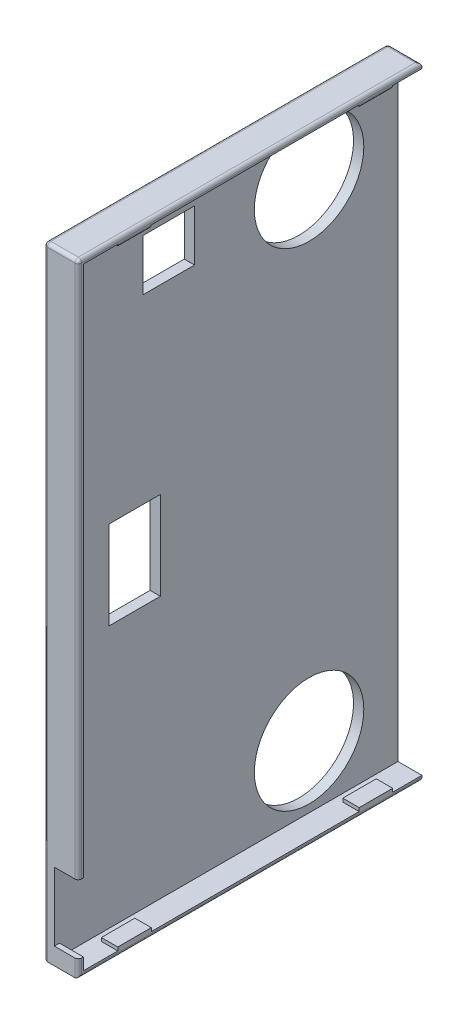
from build123d import *

# Parameters (mm, degrees)
ESBO_O1_W                 = 182
ESBO_O1_H                 = 103.5
RESSALTO_EXTRUS_O1_DEPTH  = 10
ESBO_O2_W                 = 179
ESBO_O2_H                 = 100.5
CORTE_EXTRUS_O1_DEPTH     = 7
ESBO_O4_W                 = 4.8
ESBO_O4_H                 = 9.8
RESSALTO_EXTRUS_O2_DEPTH  = 1
ESPELHAR2_COPY_1_SKETCH_W = 4.8
ESPELHAR2_COPY_1_SKETCH_H = 9.8
ESPELHAR2_COPY_1_DEPTH    = 1
ESBO_O5_W                 = 10
ESBO_O5_H                 = 182
CORTE_EXTRUS_O2_DEPTH     = 3
FILETE3_R                 = 1
FILETE8_R                 = 1
ESBO_O6_R                 = 16
CORTE_EXTRUS_O3_DEPTH     = 10
ESBO_O7_W                 = 25.8
ESBO_O7_H                 = 15
CORTE_EXTRUS_O4_DEPTH     = 10
ESBO_O9_W                 = 15
ESBO_O9_H                 = 15
CORTE_EXTRUS_O5_DEPTH     = 10
ESBO_O10_W                = 7.835934364
ESBO_O10_H                = 20
CORTE_EXTRUS_O6_DEPTH     = 10


with BuildPart() as part:
    # Esboço1 → Ressalto-extrusão1 (new body)
    with BuildSketch(Plane.YZ):
        Rectangle(ESBO_O1_W, ESBO_O1_H)
    extrude(amount=RESSALTO_EXTRUS_O1_DEPTH)

    # Esboço2 → Corte-extrusão1 (cut)
    with BuildSketch(Plane.YZ.offset(10)):
        Rectangle(ESBO_O2_W, ESBO_O2_H)
    extrude(amount=-CORTE_EXTRUS_O1_DEPTH, mode=Mode.SUBTRACT)

    # Esboço4 → Ressalto-extrusão2 (add)
    with BuildSketch(Plane(origin=(0, -89.5, 0), x_dir=(-1, 0, 0), z_dir=(0, 1, 0))):
        with Locations((-7.6, 35.3)):
            Rectangle(ESBO_O4_W, ESBO_O4_H)
    ressalto_extrus_o2 = extrude(amount=RESSALTO_EXTRUS_O2_DEPTH)

    # Espelhar1: Ressalto-extrusão2 across plane
    add(ressalto_extrus_o2.mirror(Plane.XY))

    # Espelhar2: Ressalto-extrusão2 across plane
    add(ressalto_extrus_o2.mirror(Plane.ZX))

    # Espelhar2 copy 1 sketch → Espelhar2 copy 1 (add)
    with BuildSketch(Plane(origin=(0, 89.5, 0), x_dir=(-1, 0, 0), z_dir=(0, -1, 0))):
        with Locations((-7.6, 35.3)):
            Rectangle(ESPELHAR2_COPY_1_SKETCH_W, ESPELHAR2_COPY_1_SKETCH_H)
    extrude(amount=ESPELHAR2_COPY_1_DEPTH)

    # Esboço5 → Corte-extrusão2 (cut)
    with BuildSketch(Plane(origin=(0, 0, -51.75), x_dir=(1, 0, 0), z_dir=(0, 0, -1))):
        with Locations((5, 0)):
            Rectangle(ESBO_O5_W, ESBO_O5_H)
    extrude(amount=-CORTE_EXTRUS_O2_DEPTH, mode=Mode.SUBTRACT)

    # Filete3
    filete3_edges = [part.edges().sort_by_distance(p)[0] for p in [
        (10, 0, 51.75),
        (10, -91, 1.5),
        (0, 0, 51.75),
        (0, -91, 1.5),
        (5, 91, 51.75),
        (0, 91, 1.5),
        (10, 91, 1.5),
        (0, 0, -48.75),
        (5, -91, -48.75),
        (5, 91, -48.75),
    ]]
    fillet(filete3_edges, radius=FILETE3_R)

    # Filete8
    filete8_edges = [part.edges().sort_by_distance(p)[0] for p in [
        (7.6, 88.5, -40.2),
        (5.2, 88.5, -35.3),
        (7.6, 88.5, -30.4),
        (10, 88.5, -35.3),
        (7.6, 88.5, 30.4),
        (5.2, 88.5, 35.3),
        (7.6, 88.5, 40.2),
        (10, 88.5, 35.3),
    ]]
    fillet(filete8_edges, radius=FILETE8_R - 0.0001)  # a hair under: the kernel refuses the full size

    # Esboço6 → Corte-extrusão3 (cut)
    with BuildSketch(Plane(origin=(0, 0, 0), x_dir=(0, -1, 0), z_dir=(-1, 0, 0))):
        with Locations(Location((-71.25, -22.75, 0), (0, 0, 90))):
            Circle(ESBO_O6_R)
    corte_extrus_o3 = extrude(amount=-CORTE_EXTRUS_O3_DEPTH, mode=Mode.SUBTRACT)

    # Espelhar3: Corte-extrusão3 across plane
    add(corte_extrus_o3.mirror(Plane.ZX), mode=Mode.SUBTRACT)

    # Esboço7 → Corte-extrusão4 (cut)
    with BuildSketch(Plane(origin=(0, 0, 0), x_dir=(0, -1, 0), z_dir=(-1, 0, 0))):
        with Locations((0, 28.25)):
            Rectangle(ESBO_O7_W, ESBO_O7_H)
    extrude(amount=-CORTE_EXTRUS_O4_DEPTH, mode=Mode.SUBTRACT)

    # Esboço9 → Corte-extrusão5 (cut)
    with BuildSketch(Plane.YZ.offset(3)):
        with Locations((73.5, 18.25)):
            Rectangle(ESBO_O9_W, ESBO_O9_H)
    extrude(amount=-CORTE_EXTRUS_O5_DEPTH, mode=Mode.SUBTRACT)

    # Esboço10 → Corte-extrusão6 (cut)
    with BuildSketch(Plane.XY.offset(51.75)):
        with Locations((6.917967182, -76)):
            Rectangle(ESBO_O10_W, ESBO_O10_H)
    extrude(amount=-CORTE_EXTRUS_O6_DEPTH, mode=Mode.SUBTRACT)


solid = part.part
